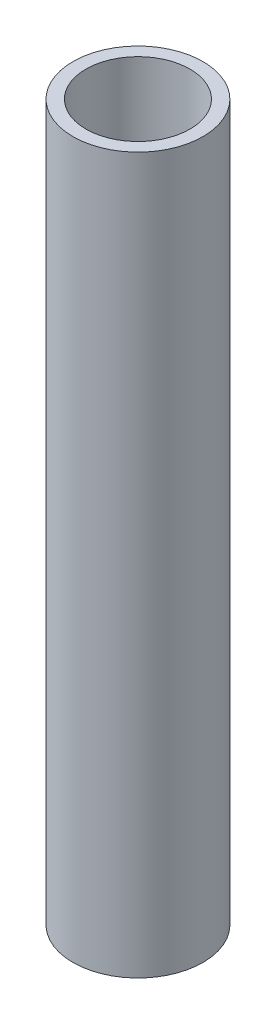
from build123d import *

# Parameters (mm, degrees)
SKETCH1_R           = 10
SKETCH1_R_2         = 8
BOSS_EXTRUDE1_DEPTH = 110


with BuildPart() as part:
    # Sketch1 → Boss-Extrude1 (new body)
    with BuildSketch(Plane(origin=(0, 0, 0), x_dir=(1, 0, 0), z_dir=(0, 1, 0))):
        Circle(SKETCH1_R)
        Circle(SKETCH1_R_2, mode=Mode.SUBTRACT)
    extrude(amount=BOSS_EXTRUDE1_DEPTH)


solid = part.part
